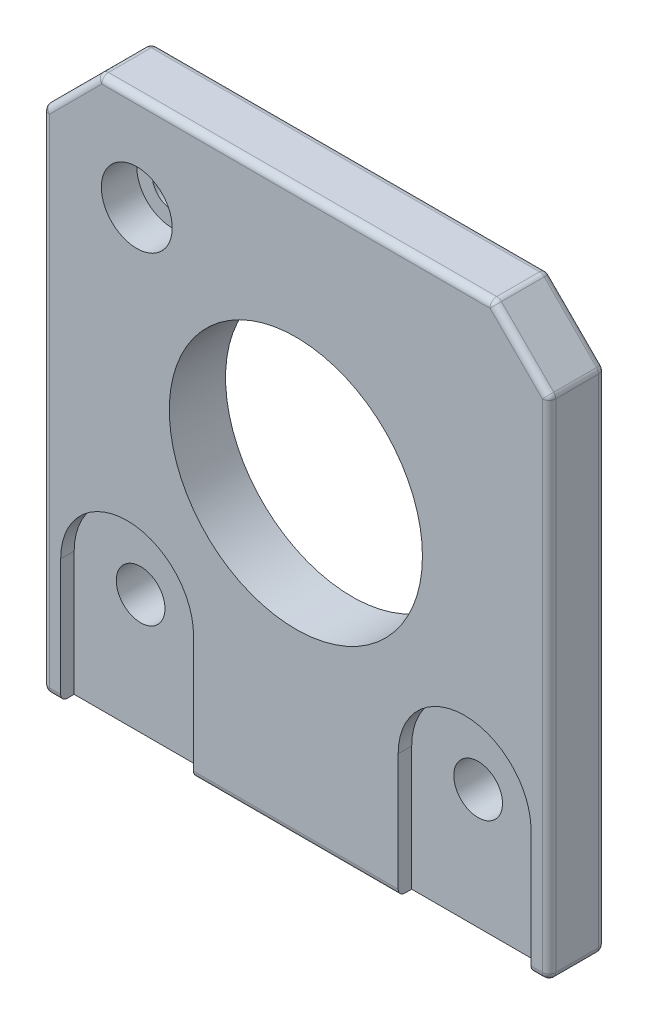
from build123d import *

# Parameters (mm, degrees)
SKETCH2_W                      = 57.15
SKETCH2_H                      = 6.35
BOSS_EXTRUDE1_DEPTH            = 63.5
SKETCH3_R                      = 14.2875
CUT_EXTRUDE1_DEPTH             = 70.922121857
CHAMFER1_SIZE                  = 6.35
M5_CLEARANCE_HOLE1_D           = 5.5
FILLET1_R                      = 0.762
CUT_EXTRUDE4_DEPTH             = 1.524
CBORE_FOR_M4_SHCS2_D           = 4.5
CBORE_FOR_M4_SHCS2_CBORE_D     = 8
CBORE_FOR_M4_SHCS2_CBORE_DEPTH = 4


with BuildPart() as part:
    # Sketch2 → Boss-Extrude1 (new body)
    with BuildSketch(Plane(origin=(0, 0, 0), x_dir=(1, 0, 0), z_dir=(0, 1, 0))):
        Rectangle(SKETCH2_W, SKETCH2_H)
    extrude(amount=-BOSS_EXTRUDE1_DEPTH)

    # Sketch3 → Cut-Extrude1 (cut, through all)
    with BuildSketch(Plane.XY.offset(3.175)):
        with Locations((0, -28.8150046)):
            Circle(SKETCH3_R)
    extrude(amount=-CUT_EXTRUDE1_DEPTH, mode=Mode.SUBTRACT)

    # Chamfer1
    chamfer1_edges = [part.edges().sort_by_distance(p)[0] for p in [
        (-28.575, 0, 0),
        (28.575, 0, 0),
    ]]
    chamfer(chamfer1_edges, length=CHAMFER1_SIZE)

    # M5 Clearance Hole1 (through all)
    with Locations(Plane.XY.offset(3.175)):
        with Locations((-19.05, -50.000003124), (19.05, -50.000003124)):
            Hole(M5_CLEARANCE_HOLE1_D / 2)

    # Fillet1
    fillet1_edges = [part.edges().sort_by_distance(p)[0] for p in [
        (0, -63.5, 3.175),
        (0, -63.5, -3.175),
        (28.575, -63.5, 0),
        (28.575, -34.925, 3.175),
        (28.575, -34.925, -3.175),
        (-28.575, -63.5, 0),
        (-28.575, -34.925, -3.175),
        (-28.575, -34.925, 3.175),
        (-25.4, -3.175, 3.175),
        (-28.575, -6.35, 0),
        (-25.4, -3.175, -3.175),
        (0, 0, 3.175),
        (-22.225, 0, 0),
        (0, 0, -3.175),
        (22.225, 0, 0),
        (25.4, -3.175, -3.175),
        (28.575, -6.35, 0),
        (25.4, -3.175, 3.175),
    ]]
    fillet(fillet1_edges, radius=FILLET1_R)

    # Sketch8 → Cut-Extrude4 (cut)
    with BuildSketch(Plane.XY.offset(3.175)):
        with BuildLine():
            Line((11.55, -63.5), (11.55, -49.5))
            ThreePointArc((11.55, -49.5), (19.05, -42), (26.55, -49.5))
            Line((26.55, -49.5), (26.55, -63.5))
            Line((26.55, -63.5), (11.55, -63.5))
        make_face()
    cut_extrude4 = extrude(amount=-CUT_EXTRUDE4_DEPTH, mode=Mode.SUBTRACT)

    # Mirror1: Cut-Extrude4 across plane
    add(cut_extrude4.mirror(Plane(origin=(0, 0, 0), x_dir=(0, 0, 1), z_dir=(1, 0, 0))), mode=Mode.SUBTRACT)

    # CBORE for M4 SHCS2 (through all)
    with Locations(Plane.XY.offset(3.175)):
        with Locations((-17.9605178, -10.8544868)):
            CounterBoreHole(CBORE_FOR_M4_SHCS2_D / 2, CBORE_FOR_M4_SHCS2_CBORE_D / 2, CBORE_FOR_M4_SHCS2_CBORE_DEPTH)


solid = part.part
